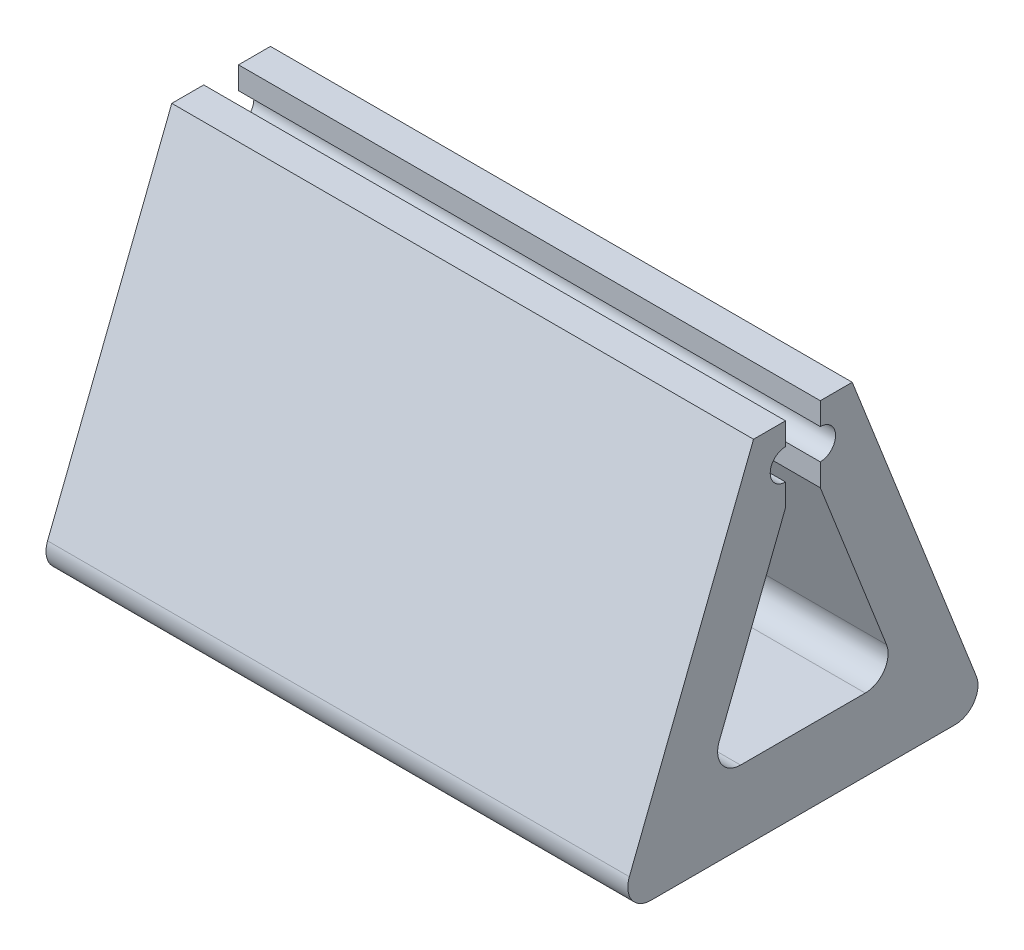
from build123d import *

# Parameters (mm, degrees)
BOSS_EXTRUDE1_DEPTH = 15.24


with BuildPart() as part:
    # Sketch1 → Boss-Extrude1 (new body)
    with BuildSketch(Plane(origin=(0, 0, 0), x_dir=(0, 0, -1), z_dir=(1, 0, 0))):
        with BuildLine():
            Line((-0.456, 6.633893366), (-0.456, 7.221647977))
            Line((-0.456, 7.221647977), (-1.292667634, 7.221647977))
            Line((-1.292667634, 7.221647977), (-4.546025715, -1.076785678))
            ThreePointArc((-4.546025715, -1.076785678), (-4.483101358, -1.633867551), (-3.98742053, -1.895783958))
            Line((-3.98742053, -1.895783958), (3.98742053, -1.895783958))
            ThreePointArc((3.98742053, -1.895783958), (4.483101358, -1.633867551), (4.546025715, -1.076785678))
            Line((4.546025715, -1.076785678), (1.292667634, 7.221647977))
            Line((1.292667634, 7.221647977), (0.456, 7.221647977))
            Line((0.456, 7.221647977), (0.456, 6.633893366))
            ThreePointArc((0.456, 6.633893366), (0.856, 6.233893366), (0.456, 5.833893366))
            Line((0.456, 5.833893366), (0.456, 5.246138756))
            Line((0.456, 5.246138756), (2.191637573, 0.81899828))
            ThreePointArc((2.191637573, 0.81899828), (2.128713216, 0.261916407), (1.633032387, 0))
            Line((1.633032387, 0), (0, 0))
            Line((0, 0), (-1.633032387, 0))
            ThreePointArc((-1.633032387, 0), (-2.128713216, 0.261916407), (-2.191637573, 0.81899828))
            Line((-2.191637573, 0.81899828), (-0.456, 5.246138756))
            Line((-0.456, 5.246138756), (-0.456, 5.833893366))
            ThreePointArc((-0.456, 5.833893366), (-0.856, 6.233893366), (-0.456, 6.633893366))
        make_face()
    extrude(amount=BOSS_EXTRUDE1_DEPTH)


solid = part.part
